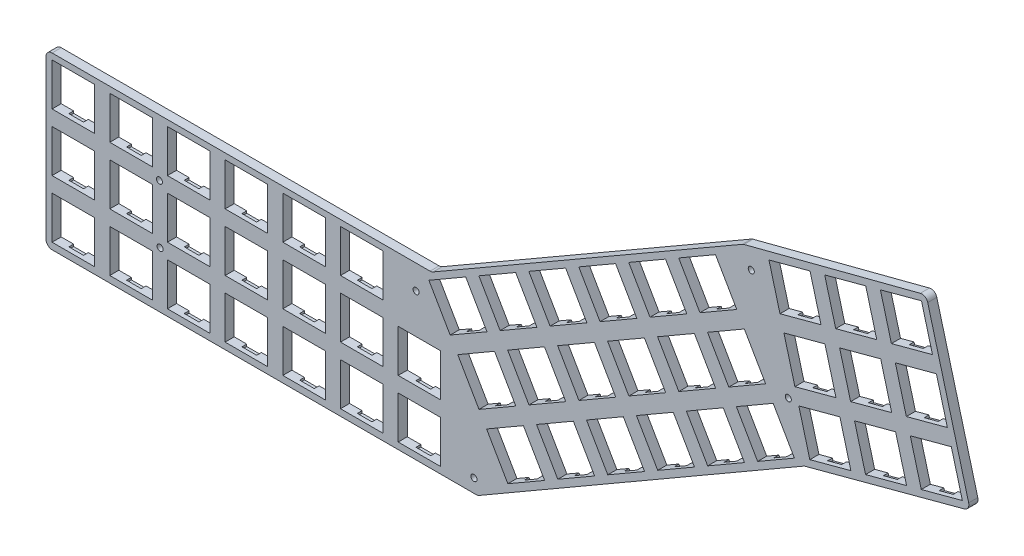
from build123d import *

# Parameters (mm, degrees)
ESQUISSE2_W                           = 14
ESQUISSE2_H                           = 14
ESQUISSE2_R                           = 1
BOSS_EXTRU_1_DEPTH                    = 3
ESQUISSE3_W                           = 4.83
ESQUISSE3_H                           = 0.7
ENL_V_MAT_EXTRU_1_DEPTH               = 1.57
R_P_TITION_LIN_AIRE1_COUNT            = 3
R_P_TITION_LIN_AIRE1_PITCH            = 19
R_P_TITION_LIN_AIRE2_COUNT            = 6
R_P_TITION_LIN_AIRE2_PITCH            = 19
R_P_TITION_LIN_AIRE2_COPY_1_SKETCH_W  = 4.83
R_P_TITION_LIN_AIRE2_COPY_1_SKETCH_H  = 0.7
R_P_TITION_LIN_AIRE2_COPY_1_DEPTH     = 1.57
R_P_TITION_LIN_AIRE2_COPY_2_SKETCH_W  = 4.83
R_P_TITION_LIN_AIRE2_COPY_2_SKETCH_H  = 0.7
R_P_TITION_LIN_AIRE2_COPY_2_DEPTH     = 1.57
R_P_TITION_LIN_AIRE2_COPY_3_SKETCH_W  = 4.83
R_P_TITION_LIN_AIRE2_COPY_3_SKETCH_H  = 0.7
R_P_TITION_LIN_AIRE2_COPY_3_DEPTH     = 1.57
R_P_TITION_LIN_AIRE2_COPY_4_SKETCH_W  = 4.83
R_P_TITION_LIN_AIRE2_COPY_4_SKETCH_H  = 0.7
R_P_TITION_LIN_AIRE2_COPY_4_DEPTH     = 1.57
R_P_TITION_LIN_AIRE2_COPY_5_SKETCH_W  = 4.83
R_P_TITION_LIN_AIRE2_COPY_5_SKETCH_H  = 0.7
R_P_TITION_LIN_AIRE2_COPY_5_DEPTH     = 1.57
R_P_TITION_LIN_AIRE2_COPY_6_SKETCH_W  = 4.83
R_P_TITION_LIN_AIRE2_COPY_6_SKETCH_H  = 0.7
R_P_TITION_LIN_AIRE2_COPY_6_DEPTH     = 1.57
R_P_TITION_LIN_AIRE2_COPY_7_SKETCH_W  = 4.83
R_P_TITION_LIN_AIRE2_COPY_7_SKETCH_H  = 0.7
R_P_TITION_LIN_AIRE2_COPY_7_DEPTH     = 1.57
R_P_TITION_LIN_AIRE2_COPY_8_SKETCH_W  = 4.83
R_P_TITION_LIN_AIRE2_COPY_8_SKETCH_H  = 0.7
R_P_TITION_LIN_AIRE2_COPY_8_DEPTH     = 1.57
R_P_TITION_LIN_AIRE2_COPY_9_SKETCH_W  = 4.83
R_P_TITION_LIN_AIRE2_COPY_9_SKETCH_H  = 0.7
R_P_TITION_LIN_AIRE2_COPY_9_DEPTH     = 1.57
R_P_TITION_LIN_AIRE2_COPY_10_SKETCH_W = 4.83
R_P_TITION_LIN_AIRE2_COPY_10_SKETCH_H = 0.7
R_P_TITION_LIN_AIRE2_COPY_10_DEPTH    = 1.57
ESQUISSE4_W                           = 4.83
ESQUISSE4_H                           = 0.7
ENL_V_MAT_EXTRU_2_DEPTH               = 1.57
R_P_TITION_LIN_AIRE3_COUNT            = 2
R_P_TITION_LIN_AIRE3_PITCH            = 19
ENL_V_MAT_EXTRU_3_DEPTH               = 1.57
R_P_TITION_LIN_AIRE4_COUNT            = 3
R_P_TITION_LIN_AIRE4_PITCH            = 19
R_P_TITION_LIN_AIRE5_COUNT            = 6
R_P_TITION_LIN_AIRE5_PITCH            = 19
R_P_TITION_LIN_AIRE5_COPY_1_DEPTH     = 1.57
R_P_TITION_LIN_AIRE5_COPY_2_DEPTH     = 1.57
R_P_TITION_LIN_AIRE5_COPY_3_DEPTH     = 1.57
R_P_TITION_LIN_AIRE5_COPY_4_DEPTH     = 1.57
R_P_TITION_LIN_AIRE5_COPY_5_DEPTH     = 1.57
R_P_TITION_LIN_AIRE5_COPY_6_DEPTH     = 1.57
R_P_TITION_LIN_AIRE5_COPY_7_DEPTH     = 1.57
R_P_TITION_LIN_AIRE5_COPY_8_DEPTH     = 1.57
R_P_TITION_LIN_AIRE5_COPY_9_DEPTH     = 1.57
R_P_TITION_LIN_AIRE5_COPY_10_DEPTH    = 1.57
ENL_V_MAT_EXTRU_4_DEPTH               = 1.57
R_P_TITION_LIN_AIRE6_COUNT            = 3
R_P_TITION_LIN_AIRE6_PITCH            = 19
R_P_TITION_LIN_AIRE7_COUNT            = 3
R_P_TITION_LIN_AIRE7_PITCH            = 19
R_P_TITION_LIN_AIRE7_COPY_1_DEPTH     = 1.57
R_P_TITION_LIN_AIRE7_COPY_2_DEPTH     = 1.57
R_P_TITION_LIN_AIRE7_COPY_3_DEPTH     = 1.57
R_P_TITION_LIN_AIRE7_COPY_4_DEPTH     = 1.57
CONG_1_R                              = 2


with BuildPart() as part:
    # Esquisse2 → Boss.-Extru.1 (new body)
    with BuildSketch(Plane.XY):
        Polygon((98.150595456, 11.331634302), (152.811395456, 25.971686302), (138.282595456, 80.221514302), (78.010935456, 64.541586302), (-24.588554544, 5.301674302), (-151.608757489, 5.292943326), (-151.608757489, -50.858487698), (-9.398592544, -50.858487698), align=None)
        with Locations((-142.608757489, -41.687645053)):
            Rectangle(ESQUISSE2_W, ESQUISSE2_H, mode=Mode.SUBTRACT)
        with Locations((-123.608757489, -41.687645053)):
            Rectangle(ESQUISSE2_W, ESQUISSE2_H, mode=Mode.SUBTRACT)
        with Locations((-104.608757489, -41.687645053)):
            Rectangle(ESQUISSE2_W, ESQUISSE2_H, mode=Mode.SUBTRACT)
        with Locations((-85.608757489, -41.687645053)):
            Rectangle(ESQUISSE2_W, ESQUISSE2_H, mode=Mode.SUBTRACT)
        with Locations((-114.030844544, -32.493525698)):
            Circle(ESQUISSE2_R, mode=Mode.SUBTRACT)
        with Locations((-142.608757489, -22.687645053)):
            Rectangle(ESQUISSE2_W, ESQUISSE2_H, mode=Mode.SUBTRACT)
        with Locations((-123.608757489, -22.687645053)):
            Rectangle(ESQUISSE2_W, ESQUISSE2_H, mode=Mode.SUBTRACT)
        with Locations((-104.608757489, -22.687645053)):
            Rectangle(ESQUISSE2_W, ESQUISSE2_H, mode=Mode.SUBTRACT)
        with Locations((-85.608757489, -22.687645053)):
            Rectangle(ESQUISSE2_W, ESQUISSE2_H, mode=Mode.SUBTRACT)
        with Locations((-66.608757489, -41.687645053)):
            Rectangle(ESQUISSE2_W, ESQUISSE2_H, mode=Mode.SUBTRACT)
        with Locations((-47.608757489, -41.687645053)):
            Rectangle(ESQUISSE2_W, ESQUISSE2_H, mode=Mode.SUBTRACT)
        with Locations((-10.652844544, -46.438125698)):
            Circle(ESQUISSE2_R, mode=Mode.SUBTRACT)
        with Locations((-28.608757489, -41.687645053)):
            Rectangle(ESQUISSE2_W, ESQUISSE2_H, mode=Mode.SUBTRACT)
        with Locations((-66.608757489, -22.687645053)):
            Rectangle(ESQUISSE2_W, ESQUISSE2_H, mode=Mode.SUBTRACT)
        with Locations((-47.608757489, -22.687645053)):
            Rectangle(ESQUISSE2_W, ESQUISSE2_H, mode=Mode.SUBTRACT)
        with Locations((-28.608757489, -22.687645053)):
            Rectangle(ESQUISSE2_W, ESQUISSE2_H, mode=Mode.SUBTRACT)
        with Locations((-114.259444544, -13.418125698)):
            Circle(ESQUISSE2_R, mode=Mode.SUBTRACT)
        with Locations((-142.608757489, -3.687645053)):
            Rectangle(ESQUISSE2_W, ESQUISSE2_H, mode=Mode.SUBTRACT)
        with Locations((-123.608757489, -3.687645053)):
            Rectangle(ESQUISSE2_W, ESQUISSE2_H, mode=Mode.SUBTRACT)
        with Locations((-104.608757489, -3.687645053)):
            Rectangle(ESQUISSE2_W, ESQUISSE2_H, mode=Mode.SUBTRACT)
        with Locations((-85.608757489, -3.687645053)):
            Rectangle(ESQUISSE2_W, ESQUISSE2_H, mode=Mode.SUBTRACT)
        with Locations((-66.608757489, -3.687645053)):
            Rectangle(ESQUISSE2_W, ESQUISSE2_H, mode=Mode.SUBTRACT)
        with Locations((-47.608757489, -3.687645053)):
            Rectangle(ESQUISSE2_W, ESQUISSE2_H, mode=Mode.SUBTRACT)
        Polygon((-15.994741241, -13.947304814), (-3.870385588, -6.947304814), (3.129614412, -19.071660467), (-8.994741241, -26.071660467), align=None, mode=Mode.SUBTRACT)
        with Locations((-29.702844544, -2.648525698)):
            Circle(ESQUISSE2_R, mode=Mode.SUBTRACT)
        Polygon((-25.494741241, 2.507177858), (-13.370385588, 9.507177858), (-6.370385588, -2.617177795), (-18.494741241, -9.617177795), align=None, mode=Mode.SUBTRACT)
        Polygon((-9.040258569, 12.007177858), (3.084097084, 19.007177858), (10.084097084, 6.882822205), (-2.040258569, -0.117177795), align=None, mode=Mode.SUBTRACT)
        Polygon((-6.494741241, -30.401787486), (5.629614412, -23.401787486), (12.629614412, -35.526143139), (0.505258759, -42.526143139), align=None, mode=Mode.SUBTRACT)
        Polygon((9.959741431, -20.901787486), (22.084097084, -13.901787486), (29.084097084, -26.026143139), (16.959741431, -33.026143139), align=None, mode=Mode.SUBTRACT)
        Polygon((26.414224103, -11.401787486), (38.538579756, -4.401787486), (45.538579756, -16.526143139), (33.414224103, -23.526143139), align=None, mode=Mode.SUBTRACT)
        Polygon((0.459741431, -4.447304814), (12.584097084, 2.552695186), (19.584097084, -9.571660467), (7.459741431, -16.571660467), align=None, mode=Mode.SUBTRACT)
        Polygon((42.868706775, -1.901787486), (54.993062428, 5.098212514), (61.993062428, -7.026143139), (49.868706775, -14.026143139), align=None, mode=Mode.SUBTRACT)
        Polygon((16.914224103, 5.052695186), (29.038579756, 12.052695186), (36.038579756, -0.071660467), (23.914224103, -7.071660467), align=None, mode=Mode.SUBTRACT)
        Polygon((59.323189447, 7.598212514), (71.4475451, 14.598212514), (78.4475451, 2.473856861), (66.323189447, -4.526143139), align=None, mode=Mode.SUBTRACT)
        Polygon((33.368706775, 14.552695186), (45.493062428, 21.552695186), (52.493062428, 9.428339533), (40.368706775, 2.428339533), align=None, mode=Mode.SUBTRACT)
        Polygon((75.777672119, 17.098212514), (87.902027772, 24.098212514), (94.902027772, 11.973856861), (82.777672119, 4.973856861), align=None, mode=Mode.SUBTRACT)
        Polygon((7.414224103, 21.507177858), (19.538579756, 28.507177858), (26.538579756, 16.382822205), (14.414224103, 9.382822205), align=None, mode=Mode.SUBTRACT)
        Polygon((23.868706775, 31.007177858), (35.993062428, 38.007177858), (42.993062428, 25.882822205), (30.868706775, 18.882822205), align=None, mode=Mode.SUBTRACT)
        Polygon((49.823189447, 24.052695186), (61.9475451, 31.052695186), (68.9475451, 18.928339533), (56.823189447, 11.928339533), align=None, mode=Mode.SUBTRACT)
        Polygon((66.277672119, 33.552695186), (78.402027772, 40.552695186), (85.402027772, 28.428339533), (73.277672119, 21.428339533), align=None, mode=Mode.SUBTRACT)
        Polygon((40.323189447, 40.507177858), (52.4475451, 47.507177858), (59.4475451, 35.382822205), (47.323189447, 28.382822205), align=None, mode=Mode.SUBTRACT)
        Polygon((56.777672119, 50.007177858), (68.902027772, 57.007177858), (75.902027772, 44.882822205), (63.777672119, 37.882822205), align=None, mode=Mode.SUBTRACT)
        Polygon((99.972171674, 14.073979229), (96.348705043, 27.596940797), (109.871666611, 31.220407428), (113.495133242, 17.69744586), align=None, mode=Mode.SUBTRACT)
        with Locations((92.877555456, 28.085474302)):
            Circle(ESQUISSE2_R, mode=Mode.SUBTRACT)
        Polygon((118.324762374, 18.991541086), (114.701295742, 32.514502654), (128.22425731, 36.137969285), (131.847723942, 22.615007717), align=None, mode=Mode.SUBTRACT)
        Polygon((95.054609817, 32.426569928), (91.431143186, 45.949531496), (104.954104754, 49.572998128), (108.577571385, 36.05003656), align=None, mode=Mode.SUBTRACT)
        Polygon((136.677353073, 23.909102943), (133.053886442, 37.432064511), (146.57684801, 41.055531142), (150.200314641, 27.532569574), align=None, mode=Mode.SUBTRACT)
        Polygon((113.407200517, 37.344131785), (109.783733885, 50.867093353), (123.306695453, 54.490559985), (126.930162085, 40.967598417), align=None, mode=Mode.SUBTRACT)
        with Locations((80.685555456, 58.489274302)):
            Circle(ESQUISSE2_R, mode=Mode.SUBTRACT)
        Polygon((90.13704796, 50.779160628), (86.513581329, 64.302122196), (100.036542897, 67.925588827), (103.660009528, 54.402627259), align=None, mode=Mode.SUBTRACT)
        Polygon((131.759791216, 42.261693642), (128.136324585, 55.78465521), (141.659286153, 59.408121842), (145.282752784, 45.885160273), align=None, mode=Mode.SUBTRACT)
        Polygon((108.48963866, 55.696722485), (104.866172028, 69.219684053), (118.389133596, 72.843150684), (122.012600228, 59.320189116), align=None, mode=Mode.SUBTRACT)
        Polygon((126.842229359, 60.614284342), (123.218762728, 74.13724591), (136.741724296, 77.760712541), (140.365190927, 64.237750973), align=None, mode=Mode.SUBTRACT)
    extrude(amount=BOSS_EXTRU_1_DEPTH)

    # Esquisse3 → Enlèv. mat.-Extru.1 (cut)
    with BuildSketch(Plane(origin=(0, 0, 0), x_dir=(-1, 0, 0), z_dir=(0, 0, -1))):
        with Locations((143.081022506, 3.662354947)):
            Rectangle(ESQUISSE3_W, ESQUISSE3_H)
        with Locations((143.081022506, -11.037645053)):
            Rectangle(ESQUISSE3_W, ESQUISSE3_H)
    enl_v_mat_extru_1 = extrude(amount=-ENL_V_MAT_EXTRU_1_DEPTH, mode=Mode.SUBTRACT)

    # Répétition linéaire1: Enlèv. mat.-Extru.1 ×3
    with Locations(*[(0, -i * R_P_TITION_LIN_AIRE1_PITCH, 0) for i in range(1, R_P_TITION_LIN_AIRE1_COUNT)]):
        add(enl_v_mat_extru_1, mode=Mode.SUBTRACT)

    # Répétition linéaire2: Enlèv. mat.-Extru.1 ×6
    with Locations(*[(i * R_P_TITION_LIN_AIRE2_PITCH, 0, 0) for i in range(1, R_P_TITION_LIN_AIRE2_COUNT)]):
        add(enl_v_mat_extru_1, mode=Mode.SUBTRACT)

    # Répétition linéaire2 copy 1 sketch → Répétition linéaire2 copy 1 (cut)
    with BuildSketch(Plane(origin=(19, -19, 0), x_dir=(-1, 0, 0), z_dir=(0, 0, -1))):
        with Locations((143.081022506, 3.662354947)):
            Rectangle(R_P_TITION_LIN_AIRE2_COPY_1_SKETCH_W, R_P_TITION_LIN_AIRE2_COPY_1_SKETCH_H)
        with Locations((143.081022506, -11.037645053)):
            Rectangle(R_P_TITION_LIN_AIRE2_COPY_1_SKETCH_W, R_P_TITION_LIN_AIRE2_COPY_1_SKETCH_H)
    extrude(amount=-R_P_TITION_LIN_AIRE2_COPY_1_DEPTH, mode=Mode.SUBTRACT)

    # Répétition linéaire2 copy 2 sketch → Répétition linéaire2 copy 2 (cut)
    with BuildSketch(Plane(origin=(38, -19, 0), x_dir=(-1, 0, 0), z_dir=(0, 0, -1))):
        with Locations((143.081022506, 3.662354947)):
            Rectangle(R_P_TITION_LIN_AIRE2_COPY_2_SKETCH_W, R_P_TITION_LIN_AIRE2_COPY_2_SKETCH_H)
        with Locations((143.081022506, -11.037645053)):
            Rectangle(R_P_TITION_LIN_AIRE2_COPY_2_SKETCH_W, R_P_TITION_LIN_AIRE2_COPY_2_SKETCH_H)
    extrude(amount=-R_P_TITION_LIN_AIRE2_COPY_2_DEPTH, mode=Mode.SUBTRACT)

    # Répétition linéaire2 copy 3 sketch → Répétition linéaire2 copy 3 (cut)
    with BuildSketch(Plane(origin=(57, -19, 0), x_dir=(-1, 0, 0), z_dir=(0, 0, -1))):
        with Locations((143.081022506, 3.662354947)):
            Rectangle(R_P_TITION_LIN_AIRE2_COPY_3_SKETCH_W, R_P_TITION_LIN_AIRE2_COPY_3_SKETCH_H)
        with Locations((143.081022506, -11.037645053)):
            Rectangle(R_P_TITION_LIN_AIRE2_COPY_3_SKETCH_W, R_P_TITION_LIN_AIRE2_COPY_3_SKETCH_H)
    extrude(amount=-R_P_TITION_LIN_AIRE2_COPY_3_DEPTH, mode=Mode.SUBTRACT)

    # Répétition linéaire2 copy 4 sketch → Répétition linéaire2 copy 4 (cut)
    with BuildSketch(Plane(origin=(76, -19, 0), x_dir=(-1, 0, 0), z_dir=(0, 0, -1))):
        with Locations((143.081022506, 3.662354947)):
            Rectangle(R_P_TITION_LIN_AIRE2_COPY_4_SKETCH_W, R_P_TITION_LIN_AIRE2_COPY_4_SKETCH_H)
        with Locations((143.081022506, -11.037645053)):
            Rectangle(R_P_TITION_LIN_AIRE2_COPY_4_SKETCH_W, R_P_TITION_LIN_AIRE2_COPY_4_SKETCH_H)
    extrude(amount=-R_P_TITION_LIN_AIRE2_COPY_4_DEPTH, mode=Mode.SUBTRACT)

    # Répétition linéaire2 copy 5 sketch → Répétition linéaire2 copy 5 (cut)
    with BuildSketch(Plane(origin=(95, -19, 0), x_dir=(-1, 0, 0), z_dir=(0, 0, -1))):
        with Locations((143.081022506, 3.662354947)):
            Rectangle(R_P_TITION_LIN_AIRE2_COPY_5_SKETCH_W, R_P_TITION_LIN_AIRE2_COPY_5_SKETCH_H)
        with Locations((143.081022506, -11.037645053)):
            Rectangle(R_P_TITION_LIN_AIRE2_COPY_5_SKETCH_W, R_P_TITION_LIN_AIRE2_COPY_5_SKETCH_H)
    extrude(amount=-R_P_TITION_LIN_AIRE2_COPY_5_DEPTH, mode=Mode.SUBTRACT)

    # Répétition linéaire2 copy 6 sketch → Répétition linéaire2 copy 6 (cut)
    with BuildSketch(Plane(origin=(19, -38, 0), x_dir=(-1, 0, 0), z_dir=(0, 0, -1))):
        with Locations((143.081022506, 3.662354947)):
            Rectangle(R_P_TITION_LIN_AIRE2_COPY_6_SKETCH_W, R_P_TITION_LIN_AIRE2_COPY_6_SKETCH_H)
        with Locations((143.081022506, -11.037645053)):
            Rectangle(R_P_TITION_LIN_AIRE2_COPY_6_SKETCH_W, R_P_TITION_LIN_AIRE2_COPY_6_SKETCH_H)
    extrude(amount=-R_P_TITION_LIN_AIRE2_COPY_6_DEPTH, mode=Mode.SUBTRACT)

    # Répétition linéaire2 copy 7 sketch → Répétition linéaire2 copy 7 (cut)
    with BuildSketch(Plane(origin=(38, -38, 0), x_dir=(-1, 0, 0), z_dir=(0, 0, -1))):
        with Locations((143.081022506, 3.662354947)):
            Rectangle(R_P_TITION_LIN_AIRE2_COPY_7_SKETCH_W, R_P_TITION_LIN_AIRE2_COPY_7_SKETCH_H)
        with Locations((143.081022506, -11.037645053)):
            Rectangle(R_P_TITION_LIN_AIRE2_COPY_7_SKETCH_W, R_P_TITION_LIN_AIRE2_COPY_7_SKETCH_H)
    extrude(amount=-R_P_TITION_LIN_AIRE2_COPY_7_DEPTH, mode=Mode.SUBTRACT)

    # Répétition linéaire2 copy 8 sketch → Répétition linéaire2 copy 8 (cut)
    with BuildSketch(Plane(origin=(57, -38, 0), x_dir=(-1, 0, 0), z_dir=(0, 0, -1))):
        with Locations((143.081022506, 3.662354947)):
            Rectangle(R_P_TITION_LIN_AIRE2_COPY_8_SKETCH_W, R_P_TITION_LIN_AIRE2_COPY_8_SKETCH_H)
        with Locations((143.081022506, -11.037645053)):
            Rectangle(R_P_TITION_LIN_AIRE2_COPY_8_SKETCH_W, R_P_TITION_LIN_AIRE2_COPY_8_SKETCH_H)
    extrude(amount=-R_P_TITION_LIN_AIRE2_COPY_8_DEPTH, mode=Mode.SUBTRACT)

    # Répétition linéaire2 copy 9 sketch → Répétition linéaire2 copy 9 (cut)
    with BuildSketch(Plane(origin=(76, -38, 0), x_dir=(-1, 0, 0), z_dir=(0, 0, -1))):
        with Locations((143.081022506, 3.662354947)):
            Rectangle(R_P_TITION_LIN_AIRE2_COPY_9_SKETCH_W, R_P_TITION_LIN_AIRE2_COPY_9_SKETCH_H)
        with Locations((143.081022506, -11.037645053)):
            Rectangle(R_P_TITION_LIN_AIRE2_COPY_9_SKETCH_W, R_P_TITION_LIN_AIRE2_COPY_9_SKETCH_H)
    extrude(amount=-R_P_TITION_LIN_AIRE2_COPY_9_DEPTH, mode=Mode.SUBTRACT)

    # Répétition linéaire2 copy 10 sketch → Répétition linéaire2 copy 10 (cut)
    with BuildSketch(Plane(origin=(95, -38, 0), x_dir=(-1, 0, 0), z_dir=(0, 0, -1))):
        with Locations((143.081022506, 3.662354947)):
            Rectangle(R_P_TITION_LIN_AIRE2_COPY_10_SKETCH_W, R_P_TITION_LIN_AIRE2_COPY_10_SKETCH_H)
        with Locations((143.081022506, -11.037645053)):
            Rectangle(R_P_TITION_LIN_AIRE2_COPY_10_SKETCH_W, R_P_TITION_LIN_AIRE2_COPY_10_SKETCH_H)
    extrude(amount=-R_P_TITION_LIN_AIRE2_COPY_10_DEPTH, mode=Mode.SUBTRACT)

    # Esquisse4 → Enlèv. mat.-Extru.2 (cut)
    with BuildSketch(Plane(origin=(0, 0, 0), x_dir=(-1, 0, 0), z_dir=(0, 0, -1))):
        with Locations((28.76106948, -15.337645053)):
            Rectangle(ESQUISSE4_W, ESQUISSE4_H)
        with Locations((28.76106948, -30.037645053)):
            Rectangle(ESQUISSE4_W, ESQUISSE4_H)
    enl_v_mat_extru_2 = extrude(amount=-ENL_V_MAT_EXTRU_2_DEPTH, mode=Mode.SUBTRACT)

    # Répétition linéaire3: Enlèv. mat.-Extru.2 ×2
    with Locations(*[(0, -i * R_P_TITION_LIN_AIRE3_PITCH, 0) for i in range(1, R_P_TITION_LIN_AIRE3_COUNT)]):
        add(enl_v_mat_extru_2, mode=Mode.SUBTRACT)

    # Esquisse6 → Enlèv. mat.-Extru.3 (cut)
    with BuildSketch(Plane(origin=(0, 0, 0), x_dir=(-1, 0, 0), z_dir=(0, 0, -1))):
        Polygon((17.330819297, 7.22062039), (21.513721997, 4.80562039), (21.863602937, 5.411631954), (17.680700237, 7.826631954), align=None)
        Polygon((10.330819297, -4.903735263), (14.513721997, -7.318735263), (14.163841058, -7.924746828), (9.980938357, -5.509746828), align=None)
    enl_v_mat_extru_3 = extrude(amount=-ENL_V_MAT_EXTRU_3_DEPTH, mode=Mode.SUBTRACT)

    # Répétition linéaire4: Enlèv. mat.-Extru.3 ×3
    with Locations(*[Vector(0.4999999999994475, -0.8660254037847577, 0) * (i * R_P_TITION_LIN_AIRE4_PITCH) for i in range(1, R_P_TITION_LIN_AIRE4_COUNT)]):
        add(enl_v_mat_extru_3, mode=Mode.SUBTRACT)

    # Répétition linéaire5: Enlèv. mat.-Extru.3 ×6
    with Locations(*[Vector(0.8660254037829719, 0.5000000000025406, 0) * (i * R_P_TITION_LIN_AIRE5_PITCH) for i in range(1, R_P_TITION_LIN_AIRE5_COUNT)]):
        add(enl_v_mat_extru_3, mode=Mode.SUBTRACT)

    # Répétition linéaire5 copy 1 sketch → Répétition linéaire5 copy 1 (cut)
    with BuildSketch(Plane(origin=(25.954482672, -6.954482672, 0), x_dir=(-1, 0, 0), z_dir=(0, 0, -1))):
        Polygon((17.330819297, 7.22062039), (21.513721997, 4.80562039), (21.863602937, 5.411631954), (17.680700237, 7.826631954), align=None)
        Polygon((10.330819297, -4.903735263), (14.513721997, -7.318735263), (14.163841058, -7.924746828), (9.980938357, -5.509746828), align=None)
    extrude(amount=-R_P_TITION_LIN_AIRE5_COPY_1_DEPTH, mode=Mode.SUBTRACT)

    # Répétition linéaire5 copy 2 sketch → Répétition linéaire5 copy 2 (cut)
    with BuildSketch(Plane(origin=(42.408965344, 2.545517328, 0), x_dir=(-1, 0, 0), z_dir=(0, 0, -1))):
        Polygon((17.330819297, 7.22062039), (21.513721997, 4.80562039), (21.863602937, 5.411631954), (17.680700237, 7.826631954), align=None)
        Polygon((10.330819297, -4.903735263), (14.513721997, -7.318735263), (14.163841058, -7.924746828), (9.980938357, -5.509746828), align=None)
    extrude(amount=-R_P_TITION_LIN_AIRE5_COPY_2_DEPTH, mode=Mode.SUBTRACT)

    # Répétition linéaire5 copy 3 sketch → Répétition linéaire5 copy 3 (cut)
    with BuildSketch(Plane(origin=(58.863448016, 12.045517328, 0), x_dir=(-1, 0, 0), z_dir=(0, 0, -1))):
        Polygon((17.330819297, 7.22062039), (21.513721997, 4.80562039), (21.863602937, 5.411631954), (17.680700237, 7.826631954), align=None)
        Polygon((10.330819297, -4.903735263), (14.513721997, -7.318735263), (14.163841058, -7.924746828), (9.980938357, -5.509746828), align=None)
    extrude(amount=-R_P_TITION_LIN_AIRE5_COPY_3_DEPTH, mode=Mode.SUBTRACT)

    # Répétition linéaire5 copy 4 sketch → Répétition linéaire5 copy 4 (cut)
    with BuildSketch(Plane(origin=(75.317930687, 21.545517328, 0), x_dir=(-1, 0, 0), z_dir=(0, 0, -1))):
        Polygon((17.330819297, 7.22062039), (21.513721997, 4.80562039), (21.863602937, 5.411631954), (17.680700237, 7.826631954), align=None)
        Polygon((10.330819297, -4.903735263), (14.513721997, -7.318735263), (14.163841058, -7.924746828), (9.980938357, -5.509746828), align=None)
    extrude(amount=-R_P_TITION_LIN_AIRE5_COPY_4_DEPTH, mode=Mode.SUBTRACT)

    # Répétition linéaire5 copy 5 sketch → Répétition linéaire5 copy 5 (cut)
    with BuildSketch(Plane(origin=(91.772413359, 31.045517328, 0), x_dir=(-1, 0, 0), z_dir=(0, 0, -1))):
        Polygon((17.330819297, 7.22062039), (21.513721997, 4.80562039), (21.863602937, 5.411631954), (17.680700237, 7.826631954), align=None)
        Polygon((10.330819297, -4.903735263), (14.513721997, -7.318735263), (14.163841058, -7.924746828), (9.980938357, -5.509746828), align=None)
    extrude(amount=-R_P_TITION_LIN_AIRE5_COPY_5_DEPTH, mode=Mode.SUBTRACT)

    # Répétition linéaire5 copy 6 sketch → Répétition linéaire5 copy 6 (cut)
    with BuildSketch(Plane(origin=(35.454482672, -23.408965344, 0), x_dir=(-1, 0, 0), z_dir=(0, 0, -1))):
        Polygon((17.330819297, 7.22062039), (21.513721997, 4.80562039), (21.863602937, 5.411631954), (17.680700237, 7.826631954), align=None)
        Polygon((10.330819297, -4.903735263), (14.513721997, -7.318735263), (14.163841058, -7.924746828), (9.980938357, -5.509746828), align=None)
    extrude(amount=-R_P_TITION_LIN_AIRE5_COPY_6_DEPTH, mode=Mode.SUBTRACT)

    # Répétition linéaire5 copy 7 sketch → Répétition linéaire5 copy 7 (cut)
    with BuildSketch(Plane(origin=(51.908965344, -13.908965344, 0), x_dir=(-1, 0, 0), z_dir=(0, 0, -1))):
        Polygon((17.330819297, 7.22062039), (21.513721997, 4.80562039), (21.863602937, 5.411631954), (17.680700237, 7.826631954), align=None)
        Polygon((10.330819297, -4.903735263), (14.513721997, -7.318735263), (14.163841058, -7.924746828), (9.980938357, -5.509746828), align=None)
    extrude(amount=-R_P_TITION_LIN_AIRE5_COPY_7_DEPTH, mode=Mode.SUBTRACT)

    # Répétition linéaire5 copy 8 sketch → Répétition linéaire5 copy 8 (cut)
    with BuildSketch(Plane(origin=(68.363448016, -4.408965344, 0), x_dir=(-1, 0, 0), z_dir=(0, 0, -1))):
        Polygon((17.330819297, 7.22062039), (21.513721997, 4.80562039), (21.863602937, 5.411631954), (17.680700237, 7.826631954), align=None)
        Polygon((10.330819297, -4.903735263), (14.513721997, -7.318735263), (14.163841058, -7.924746828), (9.980938357, -5.509746828), align=None)
    extrude(amount=-R_P_TITION_LIN_AIRE5_COPY_8_DEPTH, mode=Mode.SUBTRACT)

    # Répétition linéaire5 copy 9 sketch → Répétition linéaire5 copy 9 (cut)
    with BuildSketch(Plane(origin=(84.817930687, 5.091034656, 0), x_dir=(-1, 0, 0), z_dir=(0, 0, -1))):
        Polygon((17.330819297, 7.22062039), (21.513721997, 4.80562039), (21.863602937, 5.411631954), (17.680700237, 7.826631954), align=None)
        Polygon((10.330819297, -4.903735263), (14.513721997, -7.318735263), (14.163841058, -7.924746828), (9.980938357, -5.509746828), align=None)
    extrude(amount=-R_P_TITION_LIN_AIRE5_COPY_9_DEPTH, mode=Mode.SUBTRACT)

    # Répétition linéaire5 copy 10 sketch → Répétition linéaire5 copy 10 (cut)
    with BuildSketch(Plane(origin=(101.272413359, 14.591034656, 0), x_dir=(-1, 0, 0), z_dir=(0, 0, -1))):
        Polygon((17.330819297, 7.22062039), (21.513721997, 4.80562039), (21.863602937, 5.411631954), (17.680700237, 7.826631954), align=None)
        Polygon((10.330819297, -4.903735263), (14.513721997, -7.318735263), (14.163841058, -7.924746828), (9.980938357, -5.509746828), align=None)
    extrude(amount=-R_P_TITION_LIN_AIRE5_COPY_10_DEPTH, mode=Mode.SUBTRACT)

    # Esquisse7 → Enlèv. mat.-Extru.4 (cut)
    with BuildSketch(Plane(origin=(0, 0, 0), x_dir=(-1, 0, 0), z_dir=(0, 0, -1))):
        Polygon((-95.590942143, 66.734393695), (-90.959182082, 65.493317328), (-90.774300447, 66.183304984), (-95.406060508, 67.424381352), align=None)
        Polygon((-94.582648714, 51.97035576), (-94.767530349, 51.280368103), (-99.39929041, 52.521444471), (-99.214408775, 53.211432127), align=None)
    enl_v_mat_extru_4 = extrude(amount=-ENL_V_MAT_EXTRU_4_DEPTH, mode=Mode.SUBTRACT)

    # Répétition linéaire6: Enlèv. mat.-Extru.4 ×3
    with Locations(*[Vector(0.2588190450992223, -0.9659258262899522, 0) * (i * R_P_TITION_LIN_AIRE6_PITCH) for i in range(1, R_P_TITION_LIN_AIRE6_COUNT)]):
        add(enl_v_mat_extru_4, mode=Mode.SUBTRACT)

    # Répétition linéaire7: Enlèv. mat.-Extru.4 ×3
    with Locations(*[Vector(0.9659258262899522, 0.25881904509922216, 0) * (i * R_P_TITION_LIN_AIRE7_PITCH) for i in range(1, R_P_TITION_LIN_AIRE7_COUNT)]):
        add(enl_v_mat_extru_4, mode=Mode.SUBTRACT)

    # Répétition linéaire7 copy 1 sketch → Répétition linéaire7 copy 1 (cut)
    with BuildSketch(Plane(origin=(23.270152556, -13.435028843, 0), x_dir=(-1, 0, 0), z_dir=(0, 0, -1))):
        Polygon((-95.590942143, 66.734393695), (-90.959182082, 65.493317328), (-90.774300447, 66.183304984), (-95.406060508, 67.424381352), align=None)
        Polygon((-94.582648714, 51.97035576), (-94.767530349, 51.280368103), (-99.39929041, 52.521444471), (-99.214408775, 53.211432127), align=None)
    extrude(amount=-R_P_TITION_LIN_AIRE7_COPY_1_DEPTH, mode=Mode.SUBTRACT)

    # Répétition linéaire7 copy 2 sketch → Répétition linéaire7 copy 2 (cut)
    with BuildSketch(Plane(origin=(41.622743256, -8.517466986, 0), x_dir=(-1, 0, 0), z_dir=(0, 0, -1))):
        Polygon((-95.590942143, 66.734393695), (-90.959182082, 65.493317328), (-90.774300447, 66.183304984), (-95.406060508, 67.424381352), align=None)
        Polygon((-94.582648714, 51.97035576), (-94.767530349, 51.280368103), (-99.39929041, 52.521444471), (-99.214408775, 53.211432127), align=None)
    extrude(amount=-R_P_TITION_LIN_AIRE7_COPY_2_DEPTH, mode=Mode.SUBTRACT)

    # Répétition linéaire7 copy 3 sketch → Répétition linéaire7 copy 3 (cut)
    with BuildSketch(Plane(origin=(28.187714413, -31.787619542, 0), x_dir=(-1, 0, 0), z_dir=(0, 0, -1))):
        Polygon((-95.590942143, 66.734393695), (-90.959182082, 65.493317328), (-90.774300447, 66.183304984), (-95.406060508, 67.424381352), align=None)
        Polygon((-94.582648714, 51.97035576), (-94.767530349, 51.280368103), (-99.39929041, 52.521444471), (-99.214408775, 53.211432127), align=None)
    extrude(amount=-R_P_TITION_LIN_AIRE7_COPY_3_DEPTH, mode=Mode.SUBTRACT)

    # Répétition linéaire7 copy 4 sketch → Répétition linéaire7 copy 4 (cut)
    with BuildSketch(Plane(origin=(46.540305113, -26.870057685, 0), x_dir=(-1, 0, 0), z_dir=(0, 0, -1))):
        Polygon((-95.590942143, 66.734393695), (-90.959182082, 65.493317328), (-90.774300447, 66.183304984), (-95.406060508, 67.424381352), align=None)
        Polygon((-94.582648714, 51.97035576), (-94.767530349, 51.280368103), (-99.39929041, 52.521444471), (-99.214408775, 53.211432127), align=None)
    extrude(amount=-R_P_TITION_LIN_AIRE7_COPY_4_DEPTH, mode=Mode.SUBTRACT)

    # Congé1
    cong_1_edges = [part.edges().sort_by_distance(p)[0] for p in [
        (98.150595456, 11.331634302, 1.5),
        (152.811395456, 25.971686302, 1.5),
        (138.282595456, 80.221514302, 1.5),
        (78.010935456, 64.541586302, 1.5),
        (-24.588554544, 5.301674302, 1.5),
        (-9.398592544, -50.858487698, 1.5),
        (-151.608757489, -50.858487698, 1.5),
        (-151.608757489, 5.292943326, 1.5),
    ]]
    fillet(cong_1_edges, radius=CONG_1_R)


solid = part.part
